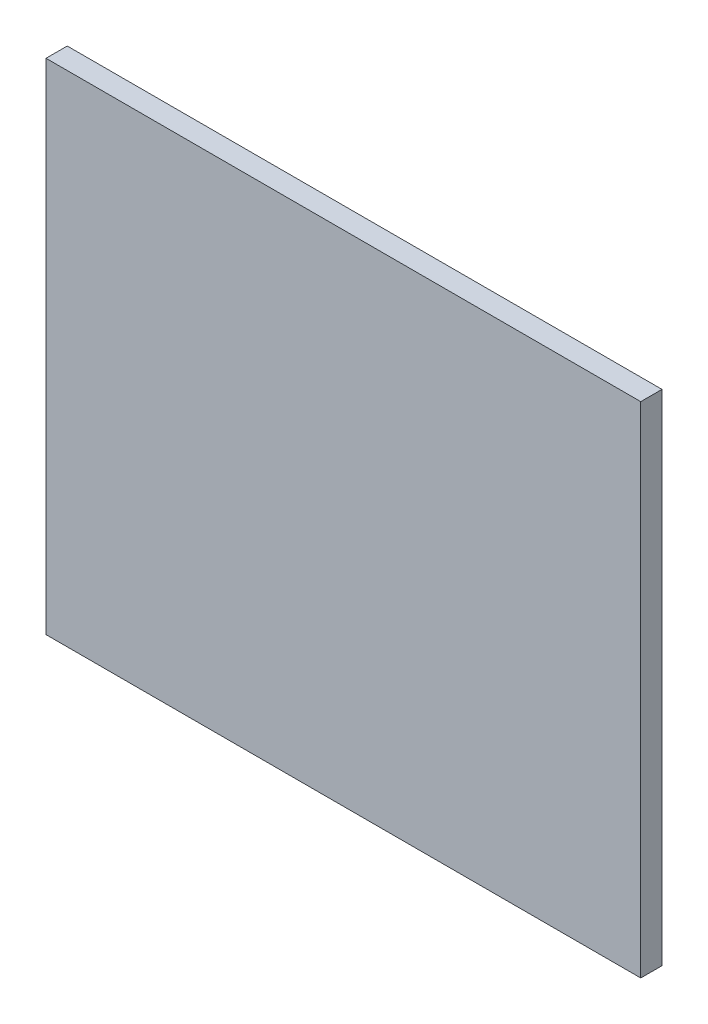
from build123d import *

# Parameters (mm, degrees)
SKETCH1_W           = 355.6
SKETCH1_H           = 298.45
BOSS_EXTRUDE1_DEPTH = 12.7


with BuildPart() as part:
    # Sketch1 → Boss-Extrude1 (new body)
    with BuildSketch(Plane.XY):
        with Locations((177.8, 149.225)):
            Rectangle(SKETCH1_W, SKETCH1_H)
    extrude(amount=BOSS_EXTRUDE1_DEPTH)


solid = part.part
